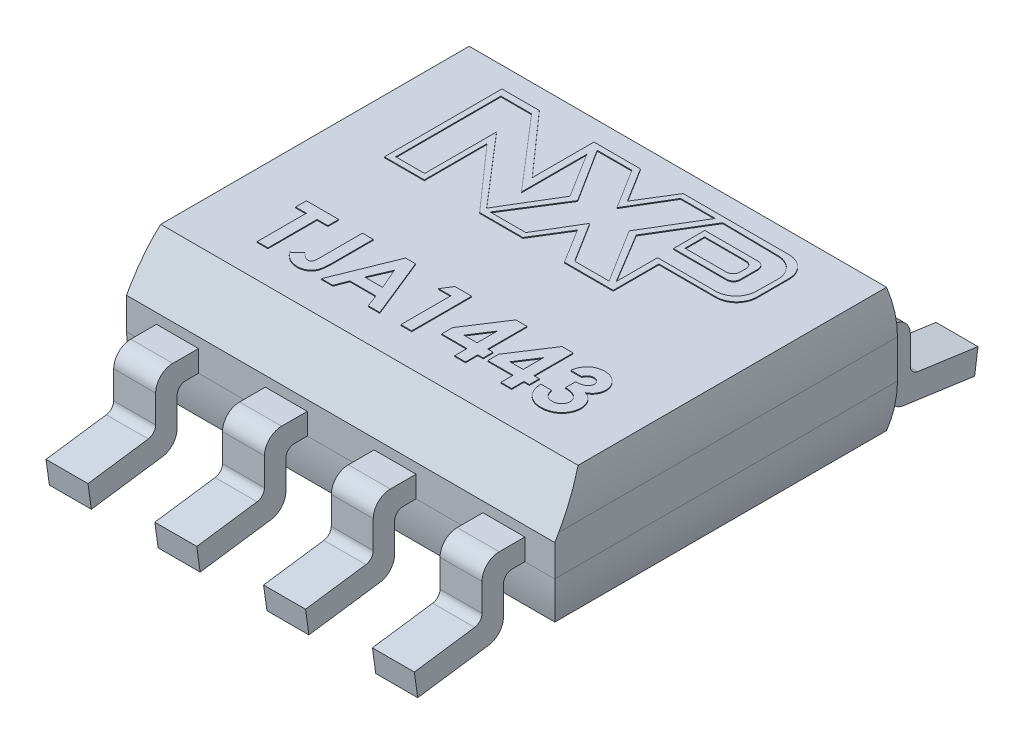
from build123d import *
from OCP.BRepAlgoAPI import BRepAlgoAPI_Cut
from OCP.TopTools import TopTools_ListOfShape

# Parameters (mm, degrees)
SKETCH1_W           = 5
SKETCH1_H           = 4
BOSS_EXTRUDE1_DEPTH = 1.45
CUT_EXTRUDE1_DEPTH  = 61.45
CUT_EXTRUDE2_DEPTH  = 61.45
BOSS_EXTRUDE2_DEPTH = 5
SKETCH7_W           = 0.35
SKETCH7_H           = 1.533953372
SKETCH7_W_2         = 0.78
SKETCH7_H_2         = 1.610570248
SKETCH7_H_3         = 1.782958217
SKETCH7_H_4         = 1.677610014
CUT_EXTRUDE3_DEPTH  = 61.45
BOSS_EXTRUDE3_DEPTH = 0.01
BOSS_EXTRUDE4_DEPTH = 0.01


with BuildPart() as part:
    # Sketch1 → Boss-Extrude1 (new body)
    with BuildSketch(Plane(origin=(0, 0, 0), x_dir=(1, 0, 0), z_dir=(0, 1, 0))):
        Rectangle(SKETCH1_W, SKETCH1_H)
    extrude(amount=BOSS_EXTRUDE1_DEPTH)

    # Sketch2 → Cut-Extrude1 (cut)
    with BuildSketch(Plane.ZY.offset(2.5)):
        Polygon((2, 0.86865368), (1.664359546, 1.45), (1.664359546, 1.731681291), (2.487143748, 1.731681291), (2.487143748, 0.86865368), align=None)
        with BuildLine():
            Line((-1.864420937, 1.672264495), (-2.155873567, 1.672264495))
            Line((-2.155873567, 1.672264495), (-2.155873567, 0.954004167))
            Line((-2.155873567, 0.954004167), (-1.999984404, 0.948389144))
            ThreePointArc((-1.999984404, 0.948389144), (-1.965805293, 1.316619369), (-1.864420937, 1.672264495))
        make_face()
        with BuildLine():
            Line((-1.999984404, 0.501610856), (-2.15587357, 0.501610856))
            Line((-2.15587357, 0.501610856), (-2.15587357, -0.22229559))
            Line((-2.15587357, -0.22229559), (-1.864420937, -0.222264495))
            ThreePointArc((-1.864420937, -0.222264495), (-1.965805293, 0.133380631), (-1.999984404, 0.501610856))
        make_face()
        with BuildLine():
            Line((2, 0.501548667), (2.487143748, 0.501548667))
            Line((2.487143748, 0.501548667), (2.487143748, -0.222291374))
            Line((2.487143748, -0.222291374), (1.864414025, -0.222322469))
            ThreePointArc((1.864414025, -0.222322469), (1.965809439, 0.133319505), (2, 0.501548667))
        make_face()
    extrude(amount=-CUT_EXTRUDE1_DEPTH, mode=Mode.SUBTRACT)


with BuildPart() as cut_extrude2_tool:
    # Sketch5 → Cut-Extrude2 (new body)
    with BuildSketch(Plane(origin=(0, 0, -2), x_dir=(-1, 0, 0), z_dir=(0, 0, -1))):
        with BuildLine():
            Line((-2.655873567, 0.954004878), (-2.499991937, 0.948390126))
            ThreePointArc((-2.499991937, 0.948390126), (-2.46581276, 1.316621068), (-2.364420937, 1.672264066))
            Line((-2.364420937, 1.672264066), (-2.655873567, 1.672264066))
            Line((-2.655873567, 1.672264066), (-2.655873567, 0.954004878))
        make_face()
        with BuildLine():
            ThreePointArc((-2.364420937, -0.222263785), (-2.46581276, 0.133379212), (-2.499991937, 0.501610155))
            Line((-2.499991937, 0.501610155), (-2.655873567, 0.495995403))
            Line((-2.65587357, 0.495995403), (-2.65587357, -0.22229488))
            Line((-2.65587357, -0.22229488), (-2.364420937, -0.222263785))
        make_face()
        with BuildLine():
            ThreePointArc((2.499991937, 0.948390126), (2.46581276, 1.316621068), (2.364420937, 1.672264066))
            Line((2.364420937, 1.672264066), (2.655873567, 1.672264066))
            Line((2.655873567, 1.672264066), (2.655873567, 0.954004878))
            Line((2.655873567, 0.954004878), (2.499991937, 0.948390126))
        make_face()
        with BuildLine():
            Line((2.499991937, 0.501610155), (2.65587357, 0.501610155))
            Line((2.65587357, 0.501610155), (2.65587357, -0.22229488))
            Line((2.65587357, -0.22229488), (2.364420937, -0.222263785))
            ThreePointArc((2.364420937, -0.222263785), (2.46581276, 0.133379212), (2.499991937, 0.501610155))
        make_face()
    extrude(amount=-CUT_EXTRUDE2_DEPTH)


with BuildPart() as part_1:
    add(part.part)

    # Cut-Extrude2: cut by cut_extrude2_tool, with a tolerance
    cut_extrude2_stock = TopTools_ListOfShape()
    cut_extrude2_stock.Append(part_1.part.wrapped)
    cut_extrude2_tools = TopTools_ListOfShape()
    cut_extrude2_tools.Append(cut_extrude2_tool.part.wrapped)
    cut_extrude2_cut = BRepAlgoAPI_Cut()
    cut_extrude2_cut.SetArguments(cut_extrude2_stock)
    cut_extrude2_cut.SetTools(cut_extrude2_tools)
    cut_extrude2_cut.SetFuzzyValue(0.00001)
    cut_extrude2_cut.Build()
    add(Compound.cast(cut_extrude2_cut.Shape()).solids(), mode=Mode.REPLACE)

    # Sketch6 → Boss-Extrude2 (add)
    with BuildSketch(Plane.ZY.offset(2.5)):
        with BuildLine():
            Line((2.300001958, 0.75), (2.253544498, 0.75))
            Line((2.253544498, 0.75), (-2.253544498, 0.75))
            Line((-2.253544498, 0.75), (-2.300001958, 0.75))
            ThreePointArc((-2.300001958, 0.75), (-2.441423314, 0.691421356), (-2.500001958, 0.55))
            Line((-2.500001958, 0.55), (-2.500001958, 0.227578594))
            ThreePointArc((-2.500001958, 0.227578594), (-2.524531, 0.161972691), (-2.586084648, 0.128551787))
            Line((-2.586084648, 0.128551787), (-3.290075098, 0.029612381))
            Line((-3.290075098, 0.029612381), (-3.250778141, -0.25))
            Line((-3.250778141, -0.25), (-2.422167338, -0.133546346))
            ThreePointArc((-2.422167338, -0.133546346), (-2.299060042, -0.066704538), (-2.250001958, 0.064507268))
            Line((-2.250001958, 0.064507268), (-2.250001958, 0.4))
            ThreePointArc((-2.250001958, 0.4), (-2.220712636, 0.470710678), (-2.150001958, 0.5))
            Line((-2.150001958, 0.5), (2.150001958, 0.5))
            ThreePointArc((2.150001958, 0.5), (2.220712636, 0.470710678), (2.250001958, 0.4))
            Line((2.250001958, 0.4), (2.250001958, 0.064507268))
            ThreePointArc((2.250001958, 0.064507268), (2.299060042, -0.066704538), (2.422167338, -0.133546346))
            Line((2.422167338, -0.133546346), (3.250778141, -0.25))
            Line((3.250778141, -0.25), (3.290075098, 0.029612381))
            Line((3.290075098, 0.029612381), (2.586084648, 0.128551787))
            ThreePointArc((2.586084648, 0.128551787), (2.524531, 0.161972691), (2.500001958, 0.227578594))
            Line((2.500001958, 0.227578594), (2.500001958, 0.55))
            ThreePointArc((2.500001958, 0.55), (2.441423314, 0.691421356), (2.300001958, 0.75))
        make_face()
    extrude(amount=-BOSS_EXTRUDE2_DEPTH)

    # Sketch7 → Cut-Extrude3 (cut)
    with BuildSketch(Plane(origin=(0, 1.45, 0), x_dir=(1, 0, 0), z_dir=(0, 1, 0))):
        with Locations((-2.325, -2.766976686)):
            Rectangle(SKETCH7_W, SKETCH7_H)
        with Locations((-1.27, -2.805285124)):
            Rectangle(SKETCH7_W_2, SKETCH7_H_2)
        with Locations((0, -2.805285124)):
            Rectangle(SKETCH7_W_2, SKETCH7_H_2)
        with Locations((2.325, -2.891479109)):
            Rectangle(SKETCH7_W, SKETCH7_H_3)
        with Locations((1.27, -2.838805007)):
            Rectangle(SKETCH7_W_2, SKETCH7_H_4)
        with Locations((1.27, 2.838805007)):
            Rectangle(SKETCH7_W_2, SKETCH7_H_4)
        with Locations((2.325, 2.891479109)):
            Rectangle(SKETCH7_W, SKETCH7_H_3)
        with Locations((0, 2.805285124)):
            Rectangle(SKETCH7_W_2, SKETCH7_H_2)
        with Locations((-1.27, 2.805285124)):
            Rectangle(SKETCH7_W_2, SKETCH7_H_2)
        with Locations((-2.325, 2.766976686)):
            Rectangle(SKETCH7_W, SKETCH7_H)
    extrude(amount=-CUT_EXTRUDE3_DEPTH, mode=Mode.SUBTRACT)

    # Sketch8 → Boss-Extrude3 (add)
    # profile 1 of 2: a face of its own
    with BuildSketch(Plane(origin=(0, 1.45, 0), x_dir=(1, 0, 0), z_dir=(0, 1, 0))):
        with BuildLine():
            Line((-1.803375496, 0.313929244), (-1.803375496, 1.686128651))
            Line((-1.803375496, 1.686128651), (-1.367177563, 1.686128651))
            Line((-1.367177563, 1.686128651), (-0.729512855, 0.965015135))
            Line((-0.729512855, 0.965015135), (-0.729512855, 1.686128651))
            Line((-0.729512855, 1.686128651), (-0.186049825, 1.686128651))
            Line((-0.186049825, 1.686128651), (0.063647762, 1.28357467))
            Line((0.063647762, 1.28357467), (0.31227987, 1.686128651))
            Line((0.31227987, 1.686128651), (1.548664193, 1.686128651))
            ThreePointArc((1.548664193, 1.686128651), (1.71836982, 1.615834278), (1.788664193, 1.446128651))
            Line((1.788664193, 1.446128651), (1.788664193, 1.073244082))
            ThreePointArc((1.788664193, 1.073244082), (1.71836982, 0.903538454), (1.548664193, 0.833244082))
            Line((1.548664193, 0.833244082), (0.881704624, 0.833244082))
            Line((0.881704624, 0.833244082), (0.881704624, 0.299873291))
            Line((0.881704624, 0.299873291), (0.31227987, 0.299873291))
            Line((0.31227987, 0.299873291), (0.063647762, 0.700709541))
            Line((0.063647762, 0.700709541), (-0.179553334, 0.306948774))
            Line((-0.179553334, 0.306948774), (-0.684190472, 0.306948774))
            Line((-0.684190472, 0.306948774), (-1.337736001, 1.046021375))
            Line((-1.337736001, 1.046021375), (-1.337736001, 0.313929244))
            Line((-1.337736001, 0.313929244), (-1.803375496, 0.313929244))
        make_face()
        Polygon((-1.737717167, 0.380080618), (-1.737717167, 1.607932124), (-1.378914568, 1.607932124), (-0.648130736, 0.758975413), (-0.648130736, 1.522116291), (-0.322062078, 0.999645994), (-0.687545107, 0.391434051), (-1.399882226, 1.218961086), (-1.399882226, 0.380080618), align=None, mode=Mode.SUBTRACT)
        Polygon((-0.627925102, 1.622168194), (-0.22215297, 1.622168194), (0.06797424, 1.157765207), (0.346386813, 1.622168194), (0.751426259, 1.622168194), (0.374330406, 0.993157662), (0.764288881, 0.368956019), (0.361905461, 0.368956019), (0.06797424, 0.839448039), (-0.211673984, 0.372983937), (-0.627925102, 0.372983937), (-0.233354138, 0.999645994), align=None, mode=Mode.SUBTRACT)
        with BuildLine():
            Line((0.838091157, 1.622168194), (1.493858319, 1.612977237))
            ThreePointArc((1.493858319, 1.612977237), (1.662562161, 1.540311479), (1.730471342, 1.369637398))
            Line((1.730471342, 1.369637398), (1.727040318, 1.124836692))
            ThreePointArc((1.727040318, 1.124836692), (1.655576174, 0.957309466), (1.487063887, 0.888200101))
            Line((1.487063887, 0.888200101), (0.811207804, 0.888200101))
            Line((0.811207804, 0.888200101), (0.811207804, 0.405870091))
            Line((0.811207804, 0.405870091), (0.45710645, 0.993157662))
            Line((0.45710645, 0.993157662), (0.838091157, 1.622168194))
        make_face(mode=Mode.SUBTRACT)
    # profile 2 of 2: a face of its own
    with BuildSketch(Plane(origin=(0, 1.45, 0), x_dir=(1, 0, 0), z_dir=(0, 1, 0))):
        with BuildLine():
            Line((0.811207804, 1.439616889), (1.43299067, 1.439616889))
            ThreePointArc((1.43299067, 1.439616889), (1.489559213, 1.416185432), (1.51299067, 1.359616889))
            Line((1.51299067, 1.359616889), (1.51299067, 1.153244082))
            ThreePointArc((1.51299067, 1.153244082), (1.489559213, 1.096675539), (1.43299067, 1.073244082))
            Line((1.43299067, 1.073244082), (0.811207804, 1.073244082))
            Line((0.811207804, 1.073244082), (0.811207804, 1.439616889))
        make_face()
        with BuildLine():
            Line((0.875476734, 1.373219945), (1.358258838, 1.373219945))
            ThreePointArc((1.358258838, 1.373219945), (1.41482738, 1.349788487), (1.438258838, 1.293219945))
            Line((1.438258838, 1.293219945), (1.438258838, 1.223991427))
            ThreePointArc((1.438258838, 1.223991427), (1.41482738, 1.167422884), (1.358258838, 1.143991427))
            Line((1.358258838, 1.143991427), (0.875476734, 1.143991427))
            Line((0.875476734, 1.143991427), (0.875476734, 1.373219945))
        make_face(mode=Mode.SUBTRACT)
    extrude(amount=BOSS_EXTRUDE3_DEPTH)

    # Sketch9 → Boss-Extrude4 (add)
    # profile 1 of 7: a face of its own
    with BuildSketch(Plane(origin=(0, 1.45, 0), x_dir=(1, 0, 0), z_dir=(0, 1, 0))):
        Polygon((-1.81434085, -0.586083303), (-1.437417773, -0.586083303), (-1.437417773, -0.711724328), (-1.563058799, -0.711724328), (-1.563058799, -1.286083303), (-1.688699825, -1.286083303), (-1.688699825, -0.711724328), (-1.81434085, -0.711724328), align=None)
    # profile 2 of 7: a face of its own
    with BuildSketch(Plane(origin=(0, 1.45, 0), x_dir=(1, 0, 0), z_dir=(0, 1, 0))):
        with BuildLine():
            Line((-1.159212645, -0.586083303), (-1.03357162, -0.586083303))
            Line((-1.03357162, -0.586083303), (-1.03357162, -1.050786828))
            add(Edge.make_bspline(
                [(-1.03357162, -1.050786828), (-1.033617683, -1.059668569), (-1.033706439, -1.076781931), (-1.034595042, -1.101418854), (-1.03579659, -1.124007236), (-1.037526935, -1.144510882), (-1.040096971, -1.162928802), (-1.043005471, -1.179306946), (-1.046214354, -1.19371205), (-1.051634945, -1.209833603), (-1.060050255, -1.227686389), (-1.072749198, -1.246969934), (-1.088563447, -1.26372405), (-1.106776238, -1.278276935), (-1.127541028, -1.289800068), (-1.150379444, -1.298129019), (-1.175218477, -1.303104792), (-1.192422632, -1.30371689), (-1.201279953, -1.304032021)],
                knots=[0, 0, 0, 0, 1.22248561, 2.355488409, 3.392943897, 4.335991845, 5.186735882, 5.951517034, 6.625683685, 7.215700098, 8.28923535, 9.333114649, 10.380102123, 11.447198135, 12.530158036, 13.633358744, 14.781567393, 16, 16, 16, 16], degree=3))
            add(Edge.make_bspline(
                [(-1.201279953, -1.304032021), (-1.210508476, -1.303746316), (-1.228710727, -1.303182795), (-1.255406203, -1.298383046), (-1.281063892, -1.290687603), (-1.305551055, -1.279560916), (-1.329203174, -1.265623237), (-1.351590985, -1.248334903), (-1.373181914, -1.228232102), (-1.385981148, -1.212805716), (-1.392545979, -1.204893399)],
                knots=[0, 0, 0, 0, 0.990984786, 1.954608977, 2.90473533, 3.862451285, 4.837525908, 5.848096122, 6.896271184, 8, 8, 8, 8], degree=3))
            Line((-1.392545979, -1.204893399), (-1.297473863, -1.116972726))
            add(Edge.make_bspline(
                [(-1.297473863, -1.116972726), (-1.292495995, -1.122601289), (-1.283181064, -1.133133845), (-1.269143738, -1.146868557), (-1.256481314, -1.157902812), (-1.24454484, -1.16586192), (-1.233280675, -1.171472202), (-1.222446464, -1.175513446), (-1.211704488, -1.17780102), (-1.204608011, -1.178197313), (-1.201139729, -1.178390995)],
                knots=[0, 0, 0, 0, 1.529509877, 2.862124173, 3.996688592, 4.944357383, 5.774364335, 6.554177287, 7.293378699, 8, 8, 8, 8], degree=3))
            add(Edge.make_bspline(
                [(-1.201139729, -1.178390995), (-1.197782817, -1.178215937), (-1.19132858, -1.177879359), (-1.182453757, -1.174137867), (-1.174971709, -1.168263568), (-1.170045971, -1.161510298), (-1.166906972, -1.154606639), (-1.164945666, -1.14793319), (-1.163084384, -1.139933535), (-1.161593166, -1.130611681), (-1.160466399, -1.119846038), (-1.159904787, -1.1077673), (-1.159221795, -1.094310196), (-1.159215804, -1.084909241), (-1.159212645, -1.079953495)],
                knots=[0, 0, 0, 0, 1.003927327, 1.930222208, 2.840933547, 3.835773585, 4.407906147, 5.114514582, 5.922289074, 6.876303333, 7.950072246, 9.174518422, 10.510537432, 12, 12, 12, 12], degree=3))
            Line((-1.159212645, -1.079953495), (-1.159212645, -0.586083303))
        make_face()
    # profile 3 of 7: a face of its own
    with BuildSketch(Plane(origin=(0, 1.45, 0), x_dir=(1, 0, 0), z_dir=(0, 1, 0))):
        Polygon((-0.656508318, -0.586083303), (-0.539981876, -0.586083303), (-0.257289568, -1.286083303), (-0.39148428, -1.286083303), (-0.445891331, -1.142493559), (-0.750879312, -1.142493559), (-0.805286363, -1.286083303), (-0.93934085, -1.286083303), align=None)
        Polygon((-0.598315209, -0.773843719), (-0.70320303, -1.016852533), (-0.493427389, -1.016852533), align=None, mode=Mode.SUBTRACT)
    # profile 4 of 7: a face of its own
    with BuildSketch(Plane(origin=(0, 1.45, 0), x_dir=(1, 0, 0), z_dir=(0, 1, 0))):
        Polygon((-0.079064408, -0.586083303), (0.115146329, -0.586083303), (0.115146329, -1.286083303), (-0.010494697, -1.286083303), (-0.010494697, -0.702749969), (-0.15408444, -0.702749969), align=None)
    # profile 5 of 7: a face of its own
    with BuildSketch(Plane(origin=(0, 1.45, 0), x_dir=(1, 0, 0), z_dir=(0, 1, 0))):
        Polygon((0.612381906, -0.568134585), (0.743351457, -0.568134585), (0.743351457, -1.025826892), (0.80617197, -1.025826892), (0.80617197, -1.142493559), (0.743351457, -1.142493559), (0.743351457, -1.286083303), (0.617710432, -1.286083303), (0.617710432, -1.142493559), (0.321556585, -1.142493559), (0.321556585, -1.015310065), align=None)
        Polygon((0.617710432, -1.025826892), (0.617710432, -0.787585706), (0.462762515, -1.025826892), align=None, mode=Mode.SUBTRACT)
    # profile 6 of 7: a face of its own
    with BuildSketch(Plane(origin=(0, 1.45, 0), x_dir=(1, 0, 0), z_dir=(0, 1, 0))):
        Polygon((1.150843444, -0.568134585), (1.281812996, -0.568134585), (1.281812996, -1.025826892), (1.344633509, -1.025826892), (1.344633509, -1.142493559), (1.281812996, -1.142493559), (1.281812996, -1.286083303), (1.15617197, -1.286083303), (1.15617197, -1.142493559), (0.860018124, -1.142493559), (0.860018124, -1.015310065), align=None)
        Polygon((1.15617197, -1.025826892), (1.15617197, -0.787585706), (1.001224053, -1.025826892), align=None, mode=Mode.SUBTRACT)
    # profile 7 of 7: a face of its own
    with BuildSketch(Plane(origin=(0, 1.45, 0), x_dir=(1, 0, 0), z_dir=(0, 1, 0))):
        with BuildLine():
            Line((1.568992483, -0.756596123), (1.443351457, -0.756596123))
            add(Edge.make_bspline(
                [(1.443351457, -0.756596123), (1.444238531, -0.750315776), (1.445977579, -0.738003573), (1.45013889, -0.720178569), (1.455116267, -0.703270333), (1.461330268, -0.68733241), (1.46861828, -0.672336409), (1.476906192, -0.658230871), (1.4862836, -0.645076339), (1.493471483, -0.637151997), (1.497057387, -0.633198687)],
                knots=[0, 0, 0, 0, 1.111473889, 2.178970933, 3.205615836, 4.199322666, 5.174200091, 6.12565194, 7.064921805, 8, 8, 8, 8], degree=3))
            add(Edge.make_bspline(
                [(1.497057387, -0.633198687), (1.502229578, -0.627982581), (1.512423424, -0.617702183), (1.529458535, -0.60453413), (1.547314478, -0.593138075), (1.566349361, -0.5841032), (1.586266988, -0.576790515), (1.607225748, -0.571878569), (1.629139999, -0.568619449), (1.644093718, -0.568298414), (1.651724855, -0.568134585)],
                knots=[0, 0, 0, 0, 1.01925491, 2.00884431, 2.983262333, 3.955970413, 4.92937149, 5.924503185, 6.940838805, 8, 8, 8, 8], degree=3))
            add(Edge.make_bspline(
                [(1.651724855, -0.568134585), (1.658509328, -0.568294753), (1.671846234, -0.568609611), (1.691448131, -0.571137122), (1.710136899, -0.575570095), (1.728110084, -0.581366107), (1.74510336, -0.589252551), (1.761491783, -0.598407034), (1.776817462, -0.609635387), (1.791116255, -0.622322296), (1.804252423, -0.63604443), (1.815628402, -0.650712263), (1.825408536, -0.665933983), (1.833466072, -0.681836054), (1.839661223, -0.698445385), (1.843960841, -0.715666024), (1.846775046, -0.733459974), (1.847055414, -0.745554282), (1.847197611, -0.751688271)],
                knots=[0, 0, 0, 0, 1.091422571, 2.145516843, 3.172569842, 4.178562979, 5.178154469, 6.181868002, 7.194278174, 8.227918432, 9.254613415, 10.245994977, 11.209837596, 12.161663635, 13.10878368, 14.055455738, 15.013766427, 16, 16, 16, 16], degree=3))
            add(Edge.make_bspline(
                [(1.847197611, -0.751688271), (1.846905814, -0.759284705), (1.846331355, -0.774239748), (1.841617506, -0.796127566), (1.834239051, -0.817056225), (1.823580154, -0.836732904), (1.810253818, -0.855104052), (1.79390285, -0.871555467), (1.774992969, -0.886345085), (1.760797069, -0.894293027), (1.753527739, -0.89836295)],
                knots=[0, 0, 0, 0, 0.992805628, 1.954529043, 2.915727527, 3.886831945, 4.871318353, 5.87440735, 6.911542536, 8, 8, 8, 8], degree=3))
            add(Edge.make_bspline(
                [(1.753527739, -0.89836295), (1.758517296, -0.900001126), (1.76832155, -0.903220069), (1.782257118, -0.909559741), (1.795508252, -0.916487952), (1.80784677, -0.924536707), (1.819395395, -0.933380549), (1.830083724, -0.943095079), (1.839975619, -0.953659116), (1.848909597, -0.965130757), (1.856838852, -0.977326535), (1.86395335, -0.989964735), (1.869808978, -1.003237019), (1.874769425, -1.016991807), (1.878546026, -1.031352721), (1.881205091, -1.046264112), (1.882742096, -1.061691968), (1.882976515, -1.07214433), (1.883095047, -1.077429456)],
                knots=[0, 0, 0, 0, 1.059543567, 2.081955587, 3.086750234, 4.076226789, 5.052108497, 6.020845489, 6.989030705, 7.970690546, 8.952259656, 9.923888338, 10.895517021, 11.877585046, 12.873342345, 13.889638361, 14.932918083, 16, 16, 16, 16], degree=3))
            add(Edge.make_bspline(
                [(1.883095047, -1.077429456), (1.882854767, -1.085196446), (1.882380985, -1.100511367), (1.879368897, -1.123068679), (1.873760932, -1.144575072), (1.866383343, -1.165278009), (1.856542441, -1.184910224), (1.844961353, -1.203922247), (1.830725869, -1.221654749), (1.814905573, -1.23857653), (1.797336212, -1.253961055), (1.778288166, -1.267298746), (1.758180286, -1.278744858), (1.736885355, -1.288037138), (1.714410771, -1.295193257), (1.690806628, -1.300366029), (1.665973747, -1.303530816), (1.649023363, -1.303862584), (1.640366682, -1.304032021)],
                knots=[0, 0, 0, 0, 1.005138573, 1.981928558, 2.936866704, 3.876260664, 4.820238198, 5.773547, 6.751179199, 7.756627054, 8.768222608, 9.766606018, 10.760583154, 11.757261445, 12.767156078, 13.807575856, 14.880313354, 16, 16, 16, 16], degree=3))
            add(Edge.make_bspline(
                [(1.640366682, -1.304032021), (1.6321776, -1.303853379), (1.616164935, -1.303504068), (1.592743061, -1.300480608), (1.570482787, -1.295603521), (1.549327304, -1.288728863), (1.529358461, -1.279813606), (1.510395173, -1.269197536), (1.492815848, -1.256268341), (1.476424618, -1.241609671), (1.461585089, -1.225163476), (1.448322046, -1.207310723), (1.436927939, -1.187983526), (1.427356042, -1.167264458), (1.419681185, -1.145117173), (1.413627281, -1.121586707), (1.409398529, -1.096627091), (1.408110654, -1.079454343), (1.407454021, -1.070698687)],
                knots=[0, 0, 0, 0, 1.066544725, 2.085487077, 3.070979577, 4.031932826, 4.977951092, 5.916076795, 6.857635327, 7.814973522, 8.776389752, 9.738577119, 10.707772778, 11.69409279, 12.707140348, 13.757286496, 14.856535458, 16, 16, 16, 16], degree=3))
            Line((1.407454021, -1.070698687), (1.533095047, -1.070698687))
            add(Edge.make_bspline(
                [(1.533095047, -1.070698687), (1.533891221, -1.075101146), (1.535441979, -1.083676089), (1.538466637, -1.0960907), (1.542408188, -1.107550153), (1.546965602, -1.118156299), (1.551888296, -1.128048392), (1.557836086, -1.136861095), (1.564373151, -1.144833707), (1.573806184, -1.154311636), (1.587291354, -1.164049812), (1.605500801, -1.172512751), (1.625757087, -1.177473072), (1.63991825, -1.178078216), (1.647237675, -1.178390995)],
                knots=[0, 0, 0, 0, 0.928156231, 1.807827665, 2.648129825, 3.438902246, 4.202261636, 4.936546065, 5.639352463, 6.338805438, 7.70633318, 9.064371875, 10.482673459, 12, 12, 12, 12], degree=3))
            add(Edge.make_bspline(
                [(1.647237675, -1.178390995), (1.651121621, -1.178324392), (1.658729401, -1.178193931), (1.669904098, -1.176747948), (1.68054957, -1.174366412), (1.690685645, -1.171129994), (1.70037685, -1.167072941), (1.709438025, -1.161841614), (1.718053859, -1.155759449), (1.72613069, -1.148921482), (1.733593848, -1.141470545), (1.739803635, -1.133219899), (1.74547893, -1.124835767), (1.74967642, -1.115769631), (1.753354325, -1.106509346), (1.755605391, -1.096718791), (1.757305107, -1.086603348), (1.757403888, -1.079680782), (1.757454021, -1.076167437)],
                knots=[0, 0, 0, 0, 1.110435564, 2.175094844, 3.216326037, 4.226890168, 5.215276772, 6.21526065, 7.213097102, 8.228249917, 9.239874822, 10.221364777, 11.178138315, 12.128914389, 13.072518965, 14.022636769, 14.996447288, 16, 16, 16, 16], degree=3))
            add(Edge.make_bspline(
                [(1.757454021, -1.076167437), (1.757320927, -1.072324996), (1.757055967, -1.064675575), (1.754891212, -1.053512855), (1.751472608, -1.042775217), (1.746723748, -1.032510214), (1.740382176, -1.02275568), (1.732899191, -1.013315909), (1.723685259, -1.004682225), (1.713576341, -0.996148091), (1.701853968, -0.988708899), (1.689089035, -0.981843618), (1.67494606, -0.976380974), (1.659770286, -0.971501822), (1.643274649, -0.967938164), (1.625561581, -0.965350601), (1.606659655, -0.963424562), (1.593630312, -0.96314824), (1.586941201, -0.96300638)],
                knots=[0, 0, 0, 0, 0.809814727, 1.612155564, 2.388397, 3.182215007, 3.988903953, 4.837162975, 5.715530372, 6.646997145, 7.623086902, 8.637258368, 9.698941581, 10.815059213, 11.996518529, 13.252603015, 14.589518788, 16, 16, 16, 16], degree=3))
            Line((1.586941201, -0.96300638), (1.586941201, -0.846339713))
            add(Edge.make_bspline(
                [(1.586941201, -0.846339713), (1.595269542, -0.845630445), (1.610850219, -0.844303544), (1.632477034, -0.841200542), (1.650684024, -0.837052868), (1.665908795, -0.832048924), (1.67855047, -0.825622557), (1.689594167, -0.818528131), (1.699105521, -0.810288992), (1.707143891, -0.80115083), (1.713574337, -0.791337301), (1.718125432, -0.781000936), (1.721130738, -0.770461556), (1.72141549, -0.763252937), (1.721556585, -0.759681059)],
                knots=[0, 0, 0, 0, 1.70044513, 3.18119609, 4.440695891, 5.496282586, 6.431922213, 7.318171381, 8.16090191, 8.983045123, 9.787564368, 10.536848927, 11.275007137, 12, 12, 12, 12], degree=3))
            add(Edge.make_bspline(
                [(1.721556585, -0.759681059), (1.721313156, -0.755123731), (1.720838033, -0.74622879), (1.717147972, -0.733498257), (1.710742443, -0.722150041), (1.702153754, -0.712208024), (1.691688138, -0.703903706), (1.679420601, -0.697874912), (1.66561735, -0.694332727), (1.655906019, -0.693965522), (1.650883509, -0.69377561)],
                knots=[0, 0, 0, 0, 1.009664648, 1.970651636, 2.907870547, 3.878035693, 4.867062054, 5.849714035, 6.887914197, 8, 8, 8, 8], degree=3))
            add(Edge.make_bspline(
                [(1.650883509, -0.69377561), (1.646331168, -0.693999686), (1.637297929, -0.69444432), (1.624088631, -0.697762953), (1.611544198, -0.703349458), (1.599924391, -0.71105292), (1.589396944, -0.720304451), (1.580756947, -0.731260969), (1.573570607, -0.74326605), (1.570524507, -0.752135346), (1.568992483, -0.756596123)],
                knots=[0, 0, 0, 0, 0.98818071, 1.960853194, 2.938124878, 3.957524365, 4.978590984, 5.968022688, 6.978025184, 8, 8, 8, 8], degree=3))
        make_face()
    extrude(amount=BOSS_EXTRUDE4_DEPTH)


solid = part_1.part
